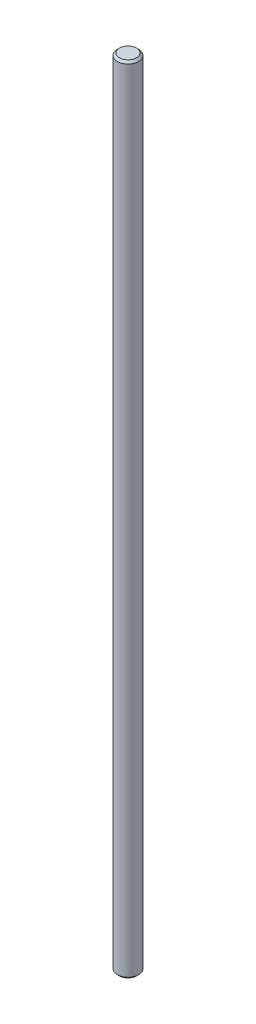
from build123d import *

# Parameters (mm, degrees)
SKETCH1_R           = 5
BOSS_EXTRUDE1_DEPTH = 375
CHAMFER1_SIZE       = 1


with BuildPart() as part:
    # Sketch1 → Boss-Extrude1 (new body)
    with BuildSketch(Plane(origin=(0, 0, 0), x_dir=(1, 0, 0), z_dir=(0, 1, 0))):
        Circle(SKETCH1_R)
    extrude(amount=BOSS_EXTRUDE1_DEPTH)

    # Chamfer1
    chamfer1_edges = [part.edges().sort_by_distance(p)[0] for p in [
        (-5, 375, 0),
        (-5, 0, 0),
    ]]
    chamfer(chamfer1_edges, length=CHAMFER1_SIZE)


solid = part.part
